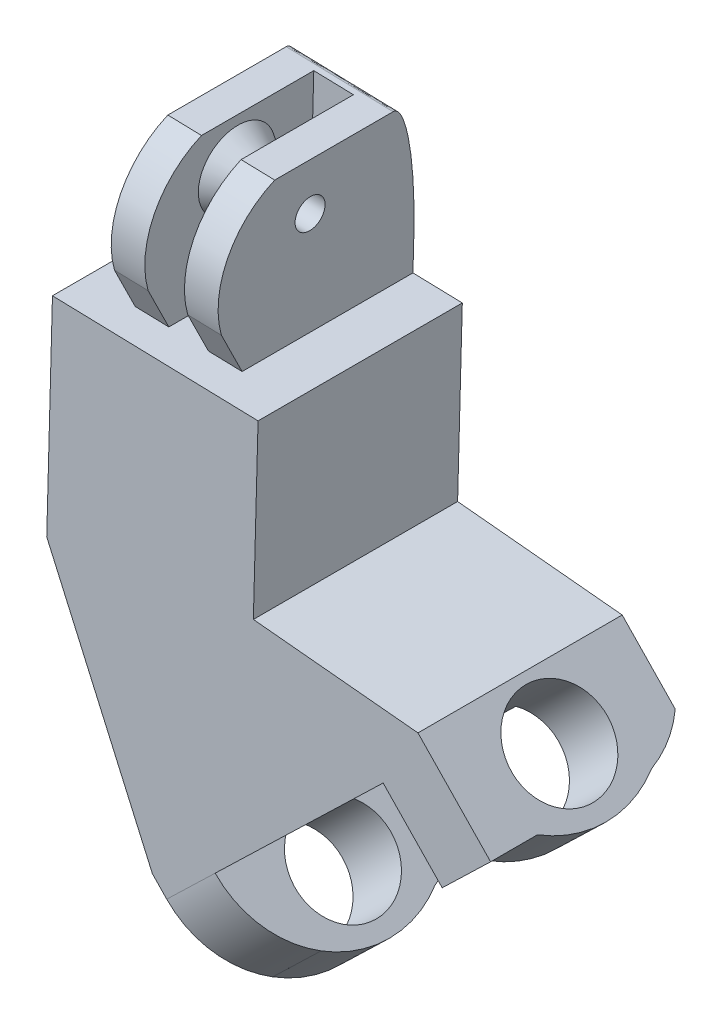
from build123d import *
from build123d.topology import SkipClean

# Parameters (mm, degrees)
BOSS_EXTRUDE1_DEPTH            = 17
CUT_EXTRUDE1_DEPTH             = 12
CUT_EXTRUDE2_DEPTH             = 35
CUT_EXTRUDE4_DEPTH             = 70
SKETCH8_R                      = 4
CUT_EXTRUDE5_DEPTH             = 47.01609876
CUT_EXTRUDE6_START             = -12.794651
SKETCH9_W                      = 3.3
SKETCH9_H                      = 13.87251724
CUT_EXTRUDE6_DEPTH             = 12.794651
F_2_5_2_5_DIAMETER_HOLE1_D     = 2.5
F_2_5_2_5_DIAMETER_HOLE1_DEPTH = 10
F_2_5_2_5_DIAMETER_HOLE1_TIP   = 0.751075774
SKETCH12_R                     = 2.25
SKETCH12_R_2                   = 1.25
EXTRUDE_THIN1_DEPTH            = 1.65
EXTRUDE_THIN1_TAPER            = -30
EXTRUDE_THIN1_OTHER_WAY_DEPTH  = 1.65
EXTRUDE_THIN1_OTHER_WAY_TAPER  = -30
SKETCH13_R                     = 1.25
CUT_EXTRUDE7_DEPTH             = 51.298409268
FILLET1_SIZE                   = 10
FILLET1_SIZE_2                 = 2


with BuildPart() as part:
    # Sketch1 → Boss-Extrude1 (new body)
    with BuildSketch(Plane.XY):
        Polygon((9.214105344, -17.845408642), (1.867831272, -10.231693567), (-6.924981548, 9.65081238), (-6.44974452, 27.27081238), (-2.341238634, 27.16), (-1.996273731, 39.95), (6.90049084, 39.710041319), (6.555525937, 26.920041319), (10.664031823, 26.80922894), (10.272676019, 12.29922894), (23.972676019, 10.97162784), (31.256458157, 3.422679717), (27.22651445, -0.465707315), (21.07453068, 5.910239336), (7.092065282, -7.581074959), (13.244049051, -13.95702161), align=None)
    extrude(amount=BOSS_EXTRUDE1_DEPTH)

    # Sketch3 → Cut-Extrude1 (cut)
    with BuildSketch(Plane(origin=(-3.071548911, 0.082844142, 0), x_dir=(0, 0, 1), z_dir=(-0.9996364686497187, 0.026961649532627044, 0))):
        with BuildLine():
            Line((0, 41.347002833), (0, 39.88165409))
            Line((0, 39.88165409), (11.85, 39.88165409))
            ThreePointArc((11.85, 39.88165409), (15.684994113, 36.06545508), (16.041740609, 30.667002833))
            Line((16.041740609, 30.667002833), (14.22, 27.087002833))
            Line((14.22, 27.087002833), (17.68, 27.087002833))
            Line((17.68, 27.087002833), (17.68, 41.347002833))
            Line((17.68, 41.347002833), (0, 41.347002833))
        make_face()
    extrude(amount=-CUT_EXTRUDE1_DEPTH, mode=Mode.SUBTRACT)

    # Sketch4 → Cut-Extrude2 (cut, symmetric)
    with BuildSketch(Plane(origin=(13.867127573, 13.38002785, 0), x_dir=(0, 0, 1), z_dir=(-0.7196328048525186, -0.6943548272894032, 0))):
        with BuildLine():
            Line((-2.314754212, -10.38), (0, -10.38))
            Line((0, -10.38), (0, -15.11))
            add(Edge.make_bspline(
                [(3.6, -17.452900819), (1.397081859, -16.752692527), (0, -15.11)],
                knots=[0, 0, 0, 1, 1, 1], degree=2))
            ThreePointArc((3.6, -17.452900819), (8.348973573, -18.829997515), (13.1, -17.46))
            Line((13.1, -17.46), (17, -17.46))
            Line((17, -17.46), (17, -10.38))
            Line((17, -10.38), (19.895245788, -10.38))
            Line((19.895245788, -10.38), (19.895245788, -23.53))
            Line((19.895245788, -23.53), (-2.314754212, -23.53))
            Line((-2.314754212, -23.53), (-2.314754212, -10.38))
        make_face()
    extrude(amount=CUT_EXTRUDE2_DEPTH, both=True, mode=Mode.SUBTRACT)

    # Sketch7 → Cut-Extrude4 (cut)
    with BuildSketch(Plane(origin=(-0.115337826, -0.111286444, 0), x_dir=(0, 0, -1), z_dir=(0.7196328048525139, 0.6943548272894081, 0))):
        with BuildLine():
            Line((-17, -17.46), (-13.094358857, -17.46))
            ThreePointArc((-13.094358857, -17.46), (-15.958832909, -14.422908382), (-17, -10.38))
            Line((-17, -10.38), (-17, -17.46))
        make_face()
    extrude(amount=-CUT_EXTRUDE4_DEPTH, mode=Mode.SUBTRACT)

    # Sketch8 → Cut-Extrude5 (cut, through all)
    with BuildSketch(Plane(origin=(17.89707128, 17.268414883, 0), x_dir=(0, 0, -1), z_dir=(0.7196328048525137, 0.6943548272894083, 0))):
        with Locations(Location((-8.5, -13.46, 0), (0, 0, 90))):
            Circle(SKETCH8_R)
    extrude(amount=-CUT_EXTRUDE5_DEPTH, mode=Mode.SUBTRACT)

    # Sketch9 → Cut-Extrude6 (cut)
    with SkipClean():  # the faces are left unmerged after this step: merging them gives an invalid solid
        with BuildSketch(Plane(origin=(1.07527518, 39.867155858, 0), x_dir=(0.9996364686497184, -0.026961649532630364, 0), z_dir=(0.026961649532630364, 0.9996364686497184, 0)).offset(CUT_EXTRUDE6_START)):
            with Locations((1.377334079, -9.43625862)):
                Rectangle(SKETCH9_W, SKETCH9_H)
        extrude(amount=CUT_EXTRUDE6_DEPTH, mode=Mode.SUBTRACT)

    # Ø2.5 (2.5) Diameter Hole1
    with Locations(Plane(origin=(-3.071548911, 0.082844142, 0), x_dir=(0, 0, 1), z_dir=(-0.9996364686497187, 0.026961649532627044, 0))):
        with Locations((8.8, 35.88165409)):
            Hole(F_2_5_2_5_DIAMETER_HOLE1_D / 2, depth=F_2_5_2_5_DIAMETER_HOLE1_DEPTH)
            with Locations((0, 0, -(F_2_5_2_5_DIAMETER_HOLE1_DEPTH + F_2_5_2_5_DIAMETER_HOLE1_TIP / 2))):  # 118° drill point
                Cone(0, F_2_5_2_5_DIAMETER_HOLE1_D / 2, F_2_5_2_5_DIAMETER_HOLE1_TIP, mode=Mode.SUBTRACT)

    # Sketch12 → Extrude-Thin1 (add)
    with SkipClean():  # the faces are left unmerged after this step: merging them gives an invalid solid
        with BuildSketch(Plane(origin=(1.376833375, -0.037135199, 0), x_dir=(0, 0, 1), z_dir=(-0.9996364686497184, 0.02696164953263036, 0))):
            with Locations((8.8, 35.88165409)):
                Circle(SKETCH12_R)
            with Locations((8.8, 35.88165409)):
                Circle(SKETCH12_R_2, mode=Mode.SUBTRACT)
        extrude(amount=-EXTRUDE_THIN1_DEPTH, taper=EXTRUDE_THIN1_TAPER)

    # Sketch12 → Extrude-Thin1 other way (add)
    with SkipClean():  # the faces are left unmerged after this step: merging them gives an invalid solid
        with BuildSketch(Plane(origin=(1.376833375, -0.037135199, 0), x_dir=(0, 0, 1), z_dir=(-0.9996364686497184, 0.02696164953263036, 0))):
            with Locations((8.8, 35.88165409)):
                Circle(SKETCH12_R)
            with Locations((8.8, 35.88165409)):
                Circle(SKETCH12_R_2, mode=Mode.SUBTRACT)
        extrude(amount=EXTRUDE_THIN1_OTHER_WAY_DEPTH, taper=EXTRUDE_THIN1_OTHER_WAY_TAPER)

    # Sketch13 → Cut-Extrude7 (cut, through all)
    with SkipClean():  # the faces are left unmerged after this step: merging them gives an invalid solid
        with BuildSketch(Plane(origin=(5.82521566, -0.157114539, 0), x_dir=(0, 0, -1), z_dir=(0.9996364686497184, -0.02696164953263123, 0))):
            with Locations(Location((-8.8, 35.88165409, 0), (0, 0, 270))):
                Circle(SKETCH13_R)
        extrude(amount=-CUT_EXTRUDE7_DEPTH, mode=Mode.SUBTRACT)

    # Fillet1
    # an asymmetric fillet: 10, 2 mm, written as the material it takes off along each edge
    with BuildSketch(Plane(origin=(-26.987185447, 40.624041238, 0), x_dir=(-0.02696164953263108, -0.9996364686497184, 0), z_dir=(0.9996364686497184, -0.02696164953263108, 0))) as fillet1_piece_1:
        with BuildLine():
            Bezier((FILLET1_SIZE, 0), (0, 0), (0, -FILLET1_SIZE_2), weights=[1, 0.707106781, 1])
            Line((0, -FILLET1_SIZE_2), (0, 0))
            Line((0, 0), (FILLET1_SIZE, 0))
        make_face()
    extrude(amount=58.9, mode=Mode.SUBTRACT)


solid = part.part
